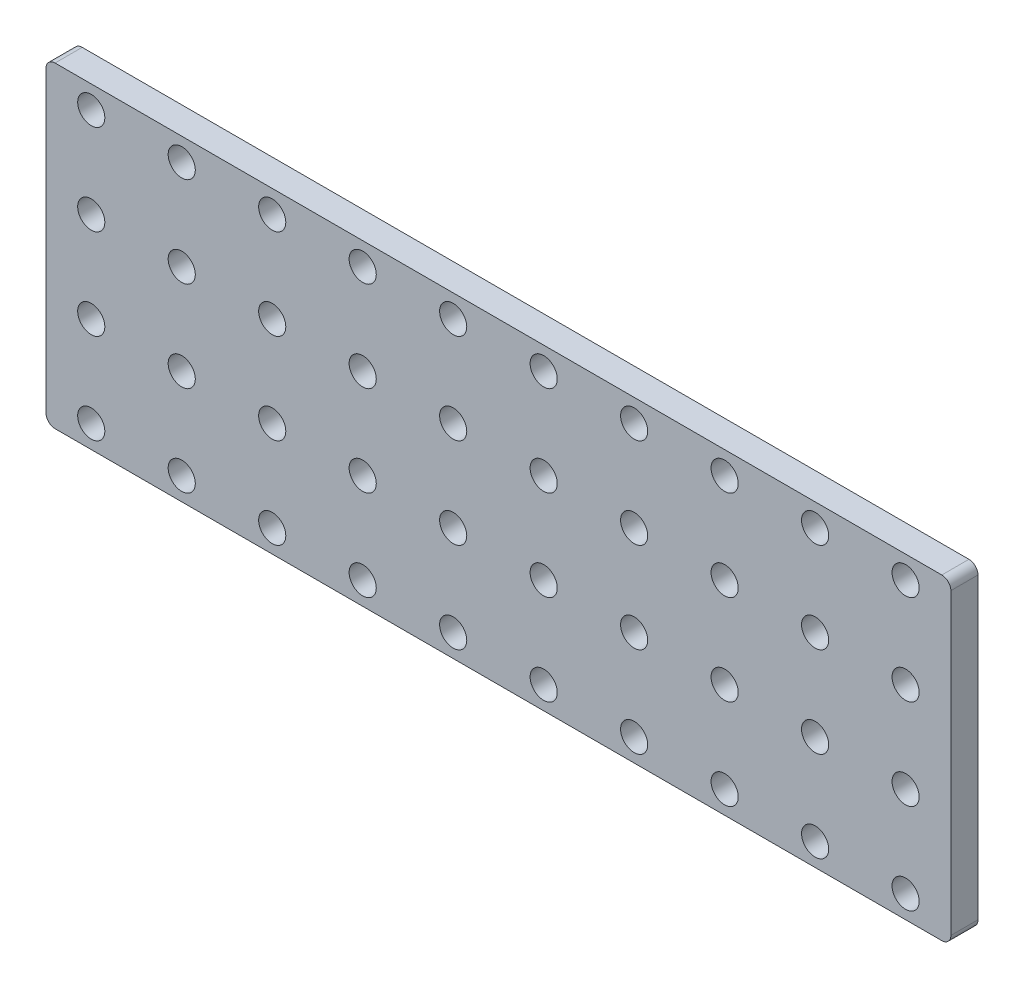
from build123d import *

# Parameters (mm, degrees)
ESQUISSE1_W             = 100
ESQUISSE1_H             = 35
BOSS_EXTRU_1_DEPTH      = 3
ESQUISSE2_R             = 1.5
ENL_V_MAT_EXTRU_1_DEPTH = 3
CONG_1_R                = 1


with BuildPart() as part:
    # Esquisse1 → Boss.-Extru.1 (new body)
    with BuildSketch(Plane.XY):
        with Locations((50, 17.5)):
            Rectangle(ESQUISSE1_W, ESQUISSE1_H)
    extrude(amount=BOSS_EXTRU_1_DEPTH)

    # Esquisse2 → Enlèv. mat.-Extru.1 (cut)
    with BuildSketch(Plane.XY.offset(3)):
        with Locations((95, 32.5)):
            Circle(ESQUISSE2_R)
        with Locations((85, 32.5)):
            Circle(ESQUISSE2_R)
        with Locations((75, 32.5)):
            Circle(ESQUISSE2_R)
        with Locations((65, 32.5)):
            Circle(ESQUISSE2_R)
        with Locations((55, 32.5)):
            Circle(ESQUISSE2_R)
        with Locations((45, 32.5)):
            Circle(ESQUISSE2_R)
        with Locations((35, 32.5)):
            Circle(ESQUISSE2_R)
        with Locations((25, 32.5)):
            Circle(ESQUISSE2_R)
        with Locations((15, 32.5)):
            Circle(ESQUISSE2_R)
        with Locations((5, 32.5)):
            Circle(ESQUISSE2_R)
        with Locations((85, 22.5)):
            Circle(ESQUISSE2_R)
        with Locations((75, 22.5)):
            Circle(ESQUISSE2_R)
        with Locations((65, 22.5)):
            Circle(ESQUISSE2_R)
        with Locations((55, 22.5)):
            Circle(ESQUISSE2_R)
        with Locations((45, 22.5)):
            Circle(ESQUISSE2_R)
        with Locations((35, 22.5)):
            Circle(ESQUISSE2_R)
        with Locations((25, 22.5)):
            Circle(ESQUISSE2_R)
        with Locations((15, 22.5)):
            Circle(ESQUISSE2_R)
        with Locations((5, 22.5)):
            Circle(ESQUISSE2_R)
        with Locations((85, 12.5)):
            Circle(ESQUISSE2_R)
        with Locations((75, 12.5)):
            Circle(ESQUISSE2_R)
        with Locations((65, 12.5)):
            Circle(ESQUISSE2_R)
        with Locations((55, 12.5)):
            Circle(ESQUISSE2_R)
        with Locations((45, 12.5)):
            Circle(ESQUISSE2_R)
        with Locations((35, 12.5)):
            Circle(ESQUISSE2_R)
        with Locations((25, 12.5)):
            Circle(ESQUISSE2_R)
        with Locations((15, 12.5)):
            Circle(ESQUISSE2_R)
        with Locations((5, 12.5)):
            Circle(ESQUISSE2_R)
        with Locations((85, 2.5)):
            Circle(ESQUISSE2_R)
        with Locations((75, 2.5)):
            Circle(ESQUISSE2_R)
        with Locations((65, 2.5)):
            Circle(ESQUISSE2_R)
        with Locations((55, 2.5)):
            Circle(ESQUISSE2_R)
        with Locations((45, 2.5)):
            Circle(ESQUISSE2_R)
        with Locations((35, 2.5)):
            Circle(ESQUISSE2_R)
        with Locations((25, 2.5)):
            Circle(ESQUISSE2_R)
        with Locations((15, 2.5)):
            Circle(ESQUISSE2_R)
        with Locations((5, 2.5)):
            Circle(ESQUISSE2_R)
        with Locations((95, 22.5)):
            Circle(ESQUISSE2_R)
        with Locations((95, 12.5)):
            Circle(ESQUISSE2_R)
        with Locations((95, 2.5)):
            Circle(ESQUISSE2_R)
    extrude(amount=-ENL_V_MAT_EXTRU_1_DEPTH, mode=Mode.SUBTRACT)

    # Congé1
    cong_1_edges = [part.edges().sort_by_distance(p)[0] for p in [
        (0, 35, 1.5),
        (0, 0, 1.5),
        (100, 0, 1.5),
        (100, 35, 1.5),
    ]]
    fillet(cong_1_edges, radius=CONG_1_R)


solid = part.part
